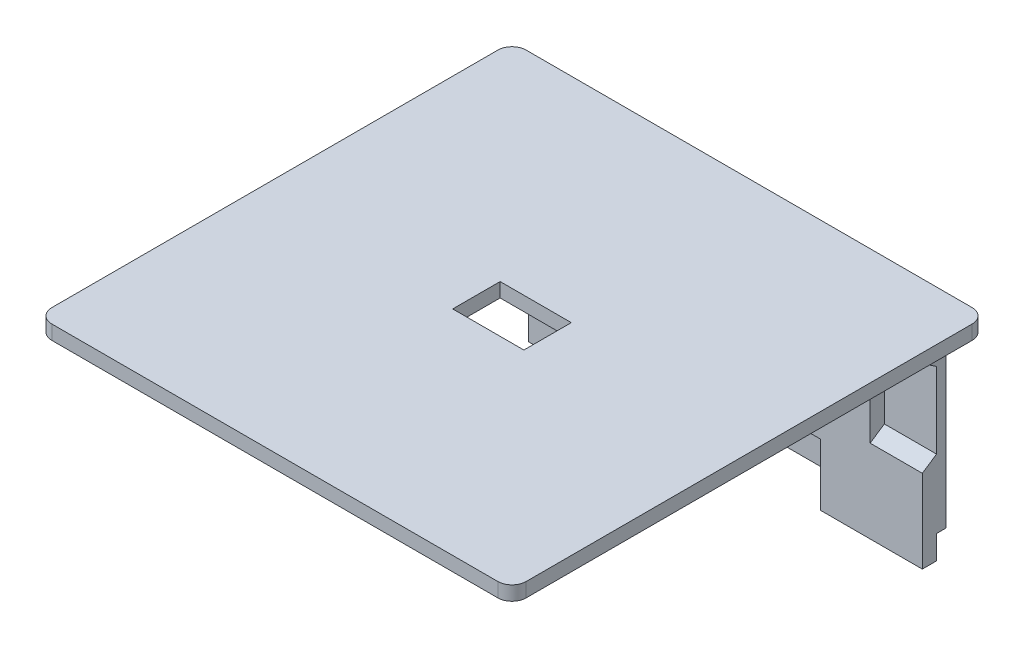
from build123d import *

# Parameters (mm, degrees)
EXTRUDE_354_DEPTH      = 3
CUT_EXTRUDE_1082_REACH = 143.453
SKETCH_3_W             = 15
SKETCH_3_H             = 10
SKETCH_4_R             = 3
SKETCH_4_R_2           = 1.5
EXTRUDE_1381_DEPTH     = 8
SKETCH_5_W             = 83
SKETCH_5_H             = 5
EXTRUDE_1698_DEPTH     = 45
SKETCH_6_W             = 2
SKETCH_6_H             = 5
CUT_EXTRUDE_1867_DEPTH = 83
SKETCH_7_W             = 40
SKETCH_7_H             = 13
TYPE_C_DEPTH           = 3
SKETCH_8_W             = 10
SKETCH_8_H             = 5
CUT_EXTRUDE_3_DEPTH    = 2
SKETCH_9_W             = 11
SKETCH_9_H             = 20
CUT_EXTRUDE_4_DEPTH    = 3
EXTRUDE_START          = -83
EXTRUDE_1_DEPTH        = 83
SKETCH_2_3_R           = 1.5
CUT_EXTRUDE_5_DEPTH    = 10


with BuildPart() as part:
    # 草图1 → Extrude 354 (new body)
    with BuildSketch(Plane(origin=(0, 0, 0), x_dir=(1, 0, 0), z_dir=(0, 1, 0))):
        with BuildLine():
            Line((3, 0), (97, 0))
            ThreePointArc((97, 0), (99.121320344, 0.878679656), (100, 3))
            Line((100, 3), (100, 97))
            ThreePointArc((100, 97), (99.121320344, 99.121320344), (97, 100))
            Line((97, 100), (3, 100))
            ThreePointArc((3, 100), (0.878679656, 99.121320344), (0, 97))
            Line((0, 97), (0, 3))
            ThreePointArc((0, 3), (0.878679656, 0.878679656), (3, 0))
        make_face()
    extrude(amount=EXTRUDE_354_DEPTH)

    # 草图3 → Cut-Extrude 1082 (cut, up to next)
    with BuildSketch(Plane(origin=(0, 3, 0), x_dir=(1, 0, 0), z_dir=(0, 1, 0)), mode=Mode.PRIVATE) as cut_extrude_1082_sk1:
        with Locations((50, 50)):
            Rectangle(SKETCH_3_W, SKETCH_3_H)
    cut_extrude_1082_tool1 = extrude(cut_extrude_1082_sk1.sketch, amount=-CUT_EXTRUDE_1082_REACH, mode=Mode.PRIVATE) & part.part
    add(cut_extrude_1082_tool1.solids().sort_by_distance((50, 3, -50))[0], mode=Mode.SUBTRACT)

    # 草图4 → Extrude 1381 (add)
    with BuildSketch(Plane.XZ):
        with Locations(Location((50, -30, 0), (0, 0, 270))):
            Circle(SKETCH_4_R)
        with Locations(Location((50, -30, 0), (0, 0, 270))):
            Circle(SKETCH_4_R_2, mode=Mode.SUBTRACT)
    extrude(amount=EXTRUDE_1381_DEPTH)

    # 草图5 → Extrude 1698 (add)
    with BuildSketch(Plane.XZ):
        with Locations((50, -97.5)):
            Rectangle(SKETCH_5_W, SKETCH_5_H)
    extrude(amount=EXTRUDE_1698_DEPTH)

    # 草图6 → Cut-Extrude 1867 (cut)
    with BuildSketch(Plane(origin=(91.5, 0, 0), x_dir=(0, 0, -1), z_dir=(1, 0, 0))):
        with Locations((99, -42.5)):
            Rectangle(SKETCH_6_W, SKETCH_6_H)
    extrude(amount=-CUT_EXTRUDE_1867_DEPTH, mode=Mode.SUBTRACT)

    # 草图7 → TYPE-C板口 (cut)
    with BuildSketch(Plane.XY.offset(-95)):
        with Locations((50, -38.5)):
            Rectangle(SKETCH_7_W, SKETCH_7_H)
    extrude(amount=-TYPE_C_DEPTH, mode=Mode.SUBTRACT)

    # 草图8 → 切除-拉伸3 (cut)
    with BuildSketch(Plane.XY.offset(-98)):
        with Locations((50, -37.5)):
            Rectangle(SKETCH_8_W, SKETCH_8_H)
    extrude(amount=-CUT_EXTRUDE_3_DEPTH, mode=Mode.SUBTRACT)

    # 草图9 → 切除-拉伸4 (cut)
    with BuildSketch(Plane.XY.offset(-95)):
        with Locations((86, -17.5)):
            Rectangle(SKETCH_9_W, SKETCH_9_H)
        with Locations((14, -17.5)):
            Rectangle(SKETCH_9_W, SKETCH_9_H)
    extrude(amount=-CUT_EXTRUDE_4_DEPTH, mode=Mode.SUBTRACT)

    # 草图10 → 凸台-拉伸1 (add)
    with BuildSketch(Plane(origin=(91.5, 0, 0), x_dir=(0, 0, -1), z_dir=(1, 0, 0)).offset(EXTRUDE_START)):
        Polygon((95, -7.5), (98, -9.5), (98, -7.5), align=None)
        Polygon((95, -27.5), (98, -25.5), (98, -27.5), align=None)
    extrude(amount=EXTRUDE_1_DEPTH)

    # 放样2: read off the stored shape, not the designer's step
    # 放样2: loft between two sections, ruled curve by curve
    loft_2_from = [
        Edge.make_bspline([(19.446610657, 0, -55.974425515), (31.395461687, 0, -57.081204201), (32.502240373, 0, -45.132353171), (20.553389343, 0, -44.025574485), (8.604538313, 0, -42.918795799), (7.497759627, 0, -54.867646829), (19.446610657, 0, -55.974425515)], [0, 0, 0, 0, 0.5, 0.5, 0.5, 1, 1, 1, 1], 3, [1, 0.333333333, 0.333333333, 1, 0.333333333, 0.333333333, 1]),
    ]
    loft_2_to = [
        Edge.make_bspline([(18.541542898, -10, -52.621622185), (23.784787268, -10, -55.538536389), (26.701701472, -10, -50.295292019), (21.458457102, -10, -47.378377815), (16.215212732, -10, -44.461463611), (13.298298528, -10, -49.704707981), (18.541542898, -10, -52.621622185)], [0, 0, 0, 0, 0.5, 0.5, 0.5, 1, 1, 1, 1], 3, [1, 0.333333333, 0.333333333, 1, 0.333333333, 0.333333333, 1]),
    ]
    loft_2 = Solid(Shell([*[Face.make_surface_from_curves(loft_2_from[k], loft_2_to[k]) for k in range(1)], Face(Wire(loft_2_from)), Face(Wire(loft_2_to))]))
    add(loft_2)

    # 草图2<3> → 切除-拉伸5 (cut)
    with BuildSketch(Plane.XZ.offset(10)):
        with Locations(Location((20, -50, 0), (0, 0, 270))):
            Circle(SKETCH_2_3_R)
    cut_extrude_5 = extrude(amount=-CUT_EXTRUDE_5_DEPTH, mode=Mode.SUBTRACT)

    # 镜向1: 放样2, 切除-拉伸5 across plane
    add(loft_2.mirror(Plane.ZY.offset(-50)))
    add(cut_extrude_5.mirror(Plane.ZY.offset(-50)), mode=Mode.SUBTRACT)


solid = part.part
